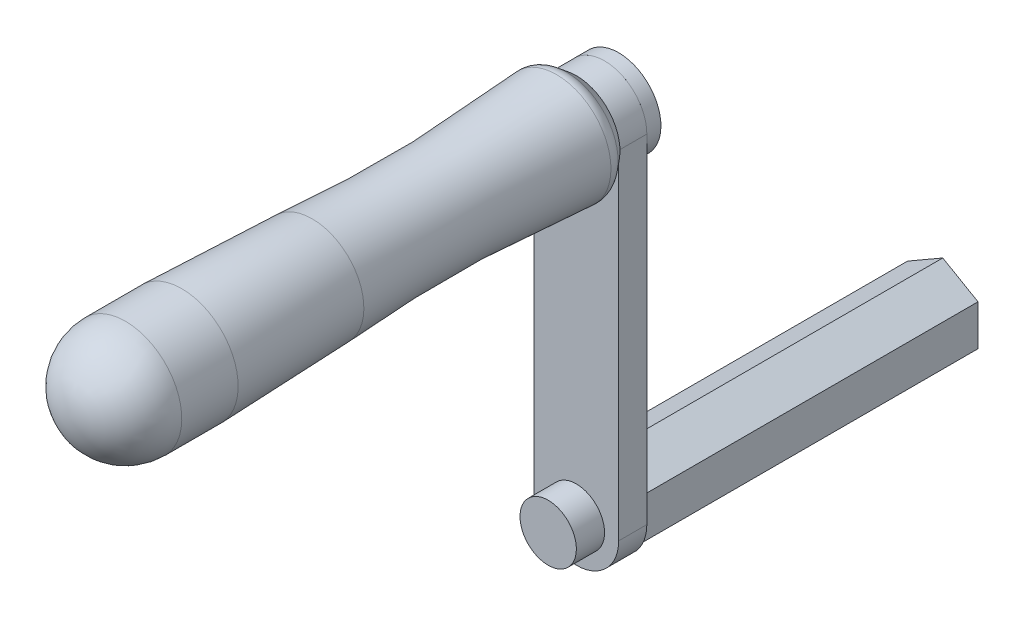
from build123d import *

# Parameters (mm, degrees)
BOSS_EXTRUDE1_DEPTH = 38.1
SKETCH2_R           = 3.175
BOSS_EXTRUDE2_DEPTH = 12.7
SKETCH5_R           = 6.35
BOSS_EXTRUDE4_DEPTH = 6.35
SKETCH3_R           = 3.175
BOSS_EXTRUDE3_DEPTH = 6.35
CHAMFER1_SIZE       = 2.880922897
FILLET1_R           = 3.175


with BuildPart() as part:
    # Sketch1 → Boss-Extrude1 (new, symmetric)
    with BuildSketch(Plane.XY):
        Polygon((0, 9.165435523), (-7.9375, 4.582717762), (-7.9375, -4.582717762), (0, -9.165435523), (7.9375, -4.582717762), (7.9375, 4.582717762), align=None)
    extrude(amount=BOSS_EXTRUDE1_DEPTH, both=True)

    # Sketch2 → Boss-Extrude2 (add)
    with BuildSketch(Plane.XY.offset(38.1)):
        Circle(SKETCH2_R)
    extrude(amount=BOSS_EXTRUDE2_DEPTH)

    # Sketch5 → Boss-Extrude4 (add)
    with BuildSketch(Plane.XY.offset(50.8)):
        Circle(SKETCH5_R)
    extrude(amount=-BOSS_EXTRUDE4_DEPTH)


with BuildPart() as body_2:
    # Sketch3 → Boss-Extrude3 (new body)
    with BuildSketch(Plane.XY.offset(44.45)):
        with BuildLine():
            Line((-9.525, 0), (-9.525, 76.2))
            ThreePointArc((-9.525, 76.2), (0, 85.725), (9.525, 76.2))
            Line((9.525, 76.2), (9.525, 0))
            ThreePointArc((9.525, 0), (0, -9.525), (-9.525, 0))
        make_face()
        Circle(SKETCH3_R, mode=Mode.SUBTRACT)
        with Locations((0, 76.2)):
            Circle(SKETCH3_R, mode=Mode.SUBTRACT)
    extrude(amount=-BOSS_EXTRUDE3_DEPTH)


with BuildPart() as body_3:
    # Sketch6 → Revolve1 (revolve)
    with BuildSketch(Plane(origin=(0, 0, 0), x_dir=(0, 0, -1), z_dir=(1, 0, 0))):
        with BuildLine():
            Line((-38.1, 79.375), (-38.1, 85.725))
            Line((-38.1, 85.725), (-34.925, 85.725))
            Line((-34.925, 85.725), (-34.925, 76.2))
            Line((-34.925, 76.2), (-158.75, 76.2))
            ThreePointArc((-158.75, 76.2), (-155.030256121, 85.180256121), (-146.05, 88.9))
            Line((-146.05, 88.9), (-133.35, 88.9))
            ThreePointArc((-133.35, 88.9), (-118.646407511, 88.633924178), (-103.962068321, 87.836045118))
            ThreePointArc((-103.962068321, 87.836045118), (-74.182011823, 87.024338682), (-44.45, 88.9))
            Line((-44.45, 88.9), (-44.45, 79.375))
            Line((-44.45, 79.375), (-38.1, 79.375))
        make_face()
    revolve(axis=Axis((0, 76.2, 34.925), (0, 0, 1)))

    # Chamfer1
    # the kernel refuses this chamfer: 3.175, 2.880922897 mm, written as the material it takes off along each edge
    with BuildSketch(Plane(origin=(0, 76.2, 44.45), x_dir=(0, 1, 0), z_dir=(1, 0, 0))) as chamfer1_piece_1:
        with BuildLine():
            Line((12.371021751, 3.173444219), (12.7 - CHAMFER1_SIZE, 0))
            Line((12.7 - CHAMFER1_SIZE, 0), (12.7, 0))
            ThreePointArc((12.7, 0), (12.527028201, 1.631208875), (12.371021751, 3.173444219))
        make_face()
    revolve(axis=Axis((0, 76.2, 44.45), (0, 0, 1)), mode=Mode.SUBTRACT)

    # Fillet1
    fillet1_edges = [body_3.edges().sort_by_distance(p)[0] for p in [
        (0, 63.828978249, 47.623444219),
    ]]
    fillet(fillet1_edges, radius=FILLET1_R)


solid = Compound([part.part, body_2.part, body_3.part])
